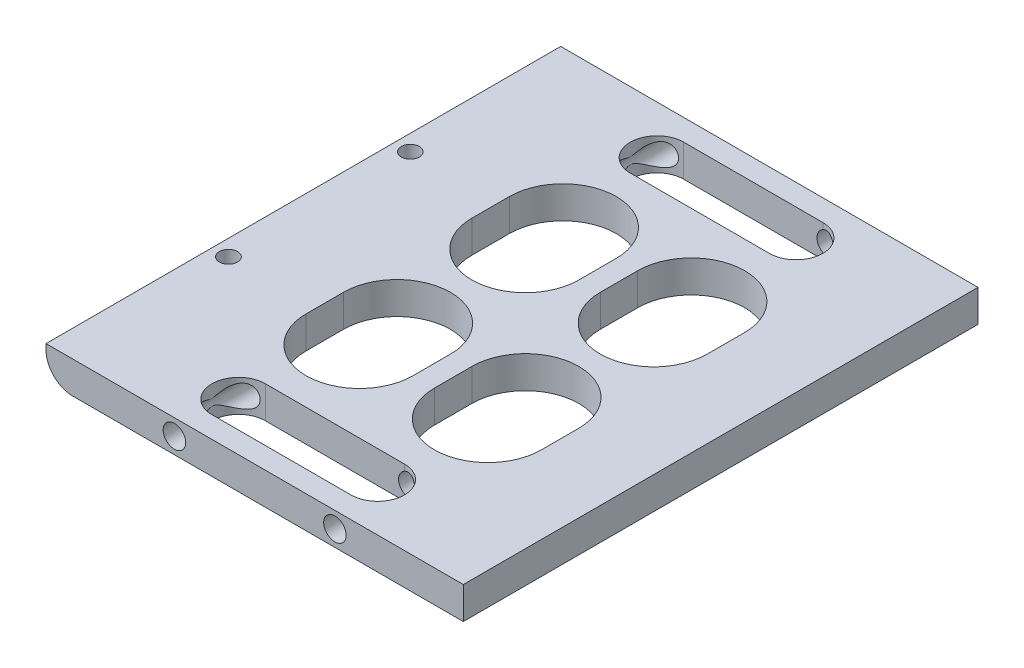
from build123d import *

# Parameters (mm, degrees)
SKETCH1_W                     = 78
SKETCH1_H                     = 96.2019
BOSS_EXTRUDE1_DEPTH           = 6
SKETCH2_R                     = 1.5
CUT_EXTRUDE2_DEPTH            = 124.995183631
SKETCH3_R                     = 2.1
CUT_EXTRUDE3_DEPTH            = 18
CUT_EXTRUDE4_START            = -78.2019
SKETCH3_2_R                   = 2.1
CUT_EXTRUDE4_DEPTH            = 18
FILLET1_R                     = 5
CUT_EXTRUDE5_DEPTH            = 10
CSK_FOR_M3_SFHCS2_D           = 3.4
CSK_FOR_M3_SFHCS2_CSINK_D     = 7.12
CSK_FOR_M3_SFHCS2_CSINK_ANGLE = 90


with BuildPart() as part:
    # Sketch1 → Boss-Extrude1 (new body)
    with BuildSketch(Plane(origin=(0, 0, 0), x_dir=(-1, 0, 0), z_dir=(0, 1, 0))):
        with Locations((39, 48.10095)):
            Rectangle(SKETCH1_W, SKETCH1_H)
    extrude(amount=BOSS_EXTRUDE1_DEPTH)

    # Sketch2 → Cut-Extrude2 (cut, through all)
    with BuildSketch(Plane(origin=(0, 0, 0), x_dir=(-1, 0, 0), z_dir=(0, -1, 0))):
        with Locations(Location((75, -31.10095, 0), (0, 0, 90))):
            Circle(SKETCH2_R)
        with Locations(Location((75, -65.10095, 0), (0, 0, 90))):
            Circle(SKETCH2_R)
    extrude(amount=-CUT_EXTRUDE2_DEPTH, mode=Mode.SUBTRACT)

    # Sketch3 → Cut-Extrude3 (cut)
    with BuildSketch(Plane(origin=(0, 0, 0), x_dir=(1, 0, 0), z_dir=(0, 0, -1))):
        with Locations(Location((-54, -3, 0), (0, 0, 180))):
            Circle(SKETCH3_R)
        with Locations(Location((-24, -3, 0), (0, 0, 180))):
            Circle(SKETCH3_R)
    extrude(amount=-CUT_EXTRUDE3_DEPTH, mode=Mode.SUBTRACT)

    # Sketch3<2> → Cut-Extrude4 (cut)
    with BuildSketch(Plane(origin=(0, 0, 0), x_dir=(1, 0, 0), z_dir=(0, 0, -1)).offset(CUT_EXTRUDE4_START)):
        with Locations(Location((-54, -3, 0), (0, 0, 180))):
            Circle(SKETCH3_2_R)
        with Locations(Location((-24, -3, 0), (0, 0, 180))):
            Circle(SKETCH3_2_R)
    extrude(amount=-CUT_EXTRUDE4_DEPTH, mode=Mode.SUBTRACT)

    # Fillet1
    # the kernel refuses this fillet: 5 mm, written as the material it takes off along each edge
    with BuildSketch(Plane(origin=(-78, 0, -12.5), x_dir=(1, 0, 0), z_dir=(0, 0, 1))) as fillet1_piece_1:
        with BuildLine():
            CenterArc((FILLET1_R, FILLET1_R), FILLET1_R, 180, 90)
            Line((0, FILLET1_R), (0, 0))
            Line((0, 0), (FILLET1_R, 0))
        make_face()
    extrude(amount=121.2019, mode=Mode.SUBTRACT)

    # Sketch4 → Cut-Extrude5 (cut)
    with BuildSketch(Plane.XZ):
        with BuildLine():
            Line((-51, 92.2019), (-25, 92.2019))
            ThreePointArc((-25, 92.2019), (-20, 87.2019), (-25, 82.2019))
            Line((-25, 82.2019), (-51, 82.2019))
            ThreePointArc((-51, 82.2019), (-56, 87.2019), (-51, 92.2019))
        make_face()
        with BuildLine():
            Line((-58.5, 29.10095), (-58.5, 36.10095))
            ThreePointArc((-58.5, 36.10095), (-48.5, 46.10095), (-38.5, 36.10095))
            Line((-38.5, 36.10095), (-38.5, 29.10095))
            ThreePointArc((-38.5, 29.10095), (-48.5, 19.10095), (-58.5, 29.10095))
        make_face()
        with BuildLine():
            Line((-38.5, 67.10095), (-38.5, 60.10095))
            ThreePointArc((-38.5, 60.10095), (-48.5, 50.10095), (-58.5, 60.10095))
            Line((-58.5, 60.10095), (-58.5, 67.10095))
            ThreePointArc((-58.5, 67.10095), (-48.5, 77.10095), (-38.5, 67.10095))
        make_face()
        with BuildLine():
            Line((-14.5, 29.10095), (-14.5, 36.10095))
            ThreePointArc((-14.5, 36.10095), (-24.5, 46.10095), (-34.5, 36.10095))
            Line((-34.5, 36.10095), (-34.5, 29.10095))
            ThreePointArc((-34.5, 29.10095), (-24.5, 19.10095), (-14.5, 29.10095))
        make_face()
        with BuildLine():
            Line((-34.5, 67.10095), (-34.5, 60.10095))
            ThreePointArc((-34.5, 60.10095), (-24.5, 50.10095), (-14.5, 60.10095))
            Line((-14.5, 60.10095), (-14.5, 67.10095))
            ThreePointArc((-14.5, 67.10095), (-24.5, 77.10095), (-34.5, 67.10095))
        make_face()
        with BuildLine():
            Line((-51, 4), (-25, 4))
            ThreePointArc((-25, 4), (-20, 9), (-25, 14))
            Line((-25, 14), (-51, 14))
            ThreePointArc((-51, 14), (-56, 9), (-51, 4))
        make_face()
    extrude(amount=-CUT_EXTRUDE5_DEPTH, mode=Mode.SUBTRACT)

    # CSK for M3 SFHCS2 (through all)
    with Locations(Plane(origin=(0, 0, 0), x_dir=(-1, 0, 0), z_dir=(0, -1, 0))):
        with Locations((75, -31.10095), (75, -65.10095)):
            CounterSinkHole(CSK_FOR_M3_SFHCS2_D / 2, CSK_FOR_M3_SFHCS2_CSINK_D / 2, counter_sink_angle=CSK_FOR_M3_SFHCS2_CSINK_ANGLE)


solid = part.part
